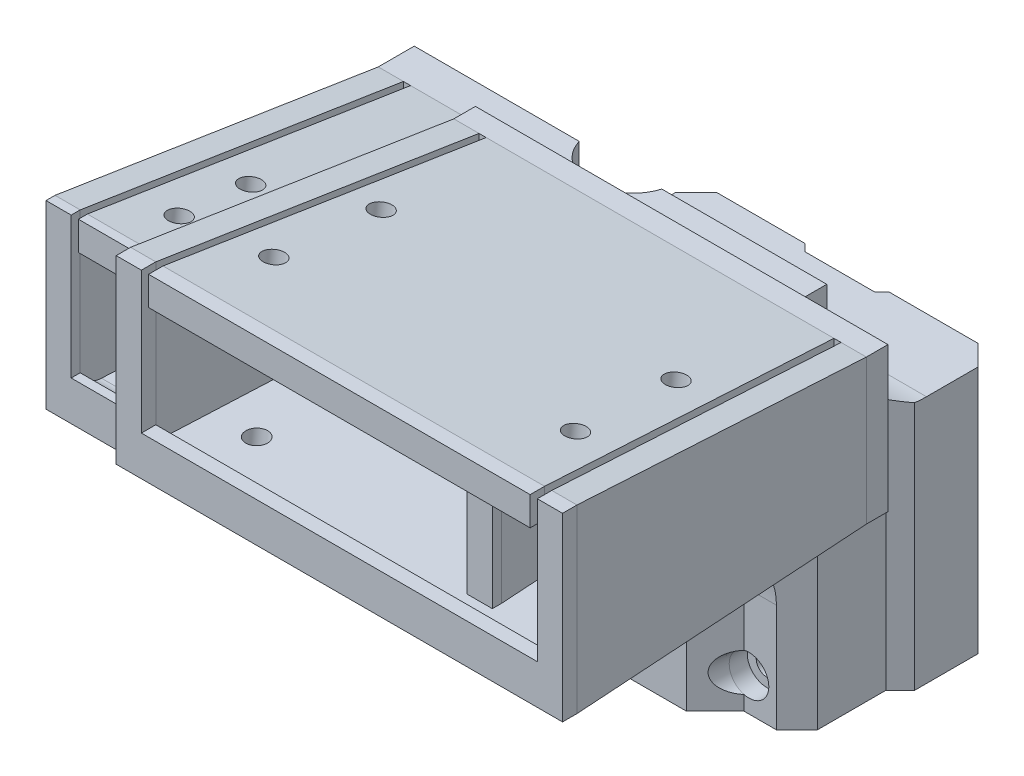
from build123d import *
from build123d.topology import SkipClean

# Parameters (mm, degrees)
BOSS_EXTRUDE1_DEPTH          = 3.5
BOSS_EXTRUDE2_DEPTH          = 31
SKETCH12_52_W                = 57.3
SKETCH12_52_H                = 20.1
BOSS_EXTRUDE5_DEPTH          = 3
SKETCH15_W                   = 53
SKETCH15_H                   = 4
BOSS_EXTRUDE6_DEPTH          = 2
CUT_EXTRUDE2_DEPTH           = 75.496191348
CUT_EXTRUDE2_DEPTH_BACK      = 75.496191348
SKETCH16_R                   = 6
CUT_EXTRUDE3_DEPTH           = 86.717904238
CUT_EXTRUDE3_DEPTH_BACK      = 86.717904238
SKETCH17_R                   = 1.5
CUT_EXTRUDE4_DEPTH           = 75.165575069
CUT_EXTRUDE4_DEPTH_BACK      = 75.165575069
SKETCH18_R                   = 1.5
FILLET7_R                    = 16
SKETCH19_R                   = 2.75
CUT_EXTRUDE5_DEPTH           = 2.5
CUT_EXTRUDE5_OTHER_WAY_DEPTH = 15
CUT_EXTRUDE5_OTHER_WAY_TAPER = -10
CUT_EXTRUDE8_DEPTH           = 88.953922769
CUT_EXTRUDE8_DEPTH_BACK      = 10
SKETCH25_R                   = 1.5
FILLET2_START                = -4
FILLET2_DEPTH                = 12.9999999
FILLET2_START_2              = 21.0000001
FILLET2_2_DEPTH              = 12.9999999
FILLET2_START_3              = -6
FILLET2_3_DEPTH              = 42
FILLET2_START_4              = 3.5
FILLET2_4_OUTLINE_R          = 6
FILLET2_4_DEPTH              = 13.5
SKETCH26_52_W                = 57.3
SKETCH26_52_H                = 20.1
BOSS_EXTRUDE9_DEPTH          = 5
SKETCH29_W                   = 53
SKETCH29_H                   = 4
BOSS_EXTRUDE10_DEPTH         = 1.25
CUT_EXTRUDE9_DEPTH           = 84.818530224
CUT_EXTRUDE9_DEPTH_BACK      = 84.818530224
SKETCH30_R                   = 1.5
CUT_EXTRUDE10_DEPTH          = 78.901749147
CUT_EXTRUDE10_DEPTH_BACK     = 78.901749147
SKETCH31_R                   = 1.75
CUT_EXTRUDE11_DEPTH          = 83.791560676
CUT_EXTRUDE11_DEPTH_BACK     = 83.791560676
SKETCH32_R                   = 6
SKETCH33_R                   = 3
CUT_EXTRUDE12_DEPTH          = 2
FILLET8_START                = -26.15
FILLET8_DEPTH                = 53
FILLET8_START_2              = -28
FILLET8_2_DEPTH              = 57
FILLET8_START_3              = 14.6
FILLET8_3_DEPTH              = 7


with BuildPart() as part:
    # Sketch2 → Boss-Extrude1 (new body)
    with BuildSketch(Plane(origin=(0, 0, 0), x_dir=(1, 0, 0), z_dir=(0, 1, 0))):
        Polygon((26.656854249, -4.5), (31.156854249, -4.5), (34, -1.656854249), (34, 7.843145751), (36, 9.843145751), (36, 18.656854249), (33.156854249, 21.5), (20.843145751, 21.5), (19.843145751, 20.5), (10.156854249, 20.5), (9.156854249, 21.5), (-3.156854249, 21.5), (-6, 18.656854249), (-6, 9.843145751), (-4, 7.843145751), (-4, -1.656854249), (-1.156854249, -4.5), (3.343145751, -4.5), (7.343145751, -8.5), (22.656854249, -8.5), align=None)
    extrude(amount=BOSS_EXTRUDE1_DEPTH)

    # Sketch2<3> → Boss-Extrude2 (add)
    with BuildSketch(Plane(origin=(0, 0, 0), x_dir=(1, 0, 0), z_dir=(0, 1, 0))):
        Polygon((26.656854249, -4.5), (31.156854249, -4.5), (34, -1.656854249), (34, 7.843145751), (36, 9.843145751), (36, 18.656854249), (33.156854249, 21.5), (20.843145751, 21.5), (19.843145751, 20.5), (10.156854249, 20.5), (9.156854249, 21.5), (-3.156854249, 21.5), (-6, 18.656854249), (-6, 9.843145751), (-4, 7.843145751), (-4, -1.656854249), (-1.156854249, -4.5), (3.343145751, -4.5), (7.343145751, -8.5), (22.656854249, -8.5), align=None)
        Polygon((25, -0.5), (29.5, -0.5), (30, 0), (30, 9.5), (32, 11.5), (32, 17), (31.5, 17.5), (22.5, 17.5), (22, 17), (22, 16.5), (8, 16.5), (8, 17), (7.5, 17.5), (-1.5, 17.5), (-2, 17), (-2, 11.5), (0, 9.5), (0, 0), (0.5, -0.5), (5, -0.5), (9, -4.5), (21, -4.5), align=None, mode=Mode.SUBTRACT)
    extrude(amount=-BOSS_EXTRUDE2_DEPTH)

    # Sketch12 → Loft9 section 0
    with BuildSketch(Plane.XY.offset(4.5)):
        with BuildLine():
            Line((40.15, 3.5), (-10.15, 3.5))
            Line((-10.15, 3.5), (-10.15, 18.1))
            Line((-10.15, 18.1), (-10.15, 20.1))
            Line((-10.15, 20.1), (-13.65, 20.1))
            Line((-13.65, 20.1), (-13.65, 0))
            Line((-13.65, 0), (43.65, 0))
            Line((43.65, 0), (43.65, 20.1))
            Line((43.65, 20.1), (40.15, 20.1))
            Line((40.15, 20.1), (40.15, 18.1))
            Line((40.15, 18.1), (40.15, 3.5))
        make_face()
    # Sketch13 → Loft9 section 1
    with BuildSketch(Plane.XY.offset(47.4)):
        with BuildLine():
            Line((-12.15, 3.5), (-12.15, 23.1))
            Line((-12.15, 23.1), (-12.15, 25.1))
            Line((-12.15, 25.1), (-15.65, 25.1))
            Line((-15.65, 25.1), (-15.65, 0))
            Line((-15.65, 0), (46.35, 0))
            Line((46.35, 0), (46.35, 25.1))
            Line((46.35, 25.1), (42.85, 25.1))
            Line((42.85, 25.1), (42.85, 23.1))
            Line((42.85, 23.1), (42.85, 3.5))
            Line((42.85, 3.5), (-12.15, 3.5))
        make_face()
    loft()



with BuildPart() as body_2:
    # Loft10: read off the stored shape, not the designer's step
    # Loft10: loft between two sections, ruled curve by curve
    loft10_from = [
        Edge.make_line((39.15, 18.1, 4.5), (-9.15, 18.1, 4.5)),
        Edge.make_line((-9.15, 18.1, 4.5), (-9.15, 20.1, 4.5)),
        Edge.make_line((39.15, 20.1, 4.5), (39.15, 18.1, 4.5)),
        Edge.make_line((-9.15, 20.1, 4.5), (39.15, 20.1, 4.5)),
    ]
    loft10_to = [
        Edge.make_line((41.85, 23.1, 47.4), (-11.15, 23.1, 47.4)),
        Edge.make_line((-11.15, 23.1, 47.4), (-11.15, 25.1, 47.4)),
        Edge.make_line((41.85, 25.1, 47.4), (41.85, 23.1, 47.4)),
        Edge.make_line((-11.15, 25.1, 47.4), (41.85, 25.1, 47.4)),
    ]
    loft10 = Solid(Shell([*[Face.make_surface_from_curves(loft10_from[k], loft10_to[k]) for k in range(4)], Face(Wire(loft10_from)), Face(Wire(loft10_to))]))
    add(loft10)


with BuildPart() as part_1:
    add(part.part)

    add(body_2.part)  # Boss-Extrude5 merges body 2
    # Sketch12<52> → Boss-Extrude5 (add)
    with BuildSketch(Plane.XY.offset(4.5)):
        with Locations((15, 10.05)):
            Rectangle(SKETCH12_52_W, SKETCH12_52_H)
    extrude(amount=-BOSS_EXTRUDE5_DEPTH)

    # Sketch15 → Boss-Extrude6 (add)
    with BuildSketch(Plane.XY.offset(47.4)):
        Polygon((42.85, 25.1), (42.85, 5.5), (-12.15, 5.5), (-12.15, 25.1), (-15.65, 25.1), (-15.65, 0), (46.35, 0), (46.35, 25.1), align=None)
        with Locations((15.35, 23.1)):
            Rectangle(SKETCH15_W, SKETCH15_H)
    extrude(amount=BOSS_EXTRUDE6_DEPTH)

    # Sketch16 → Cut-Extrude2 (cut, two sides: drawn at the far end of the back side and taken through both)
    with BuildSketch(Plane.XZ.offset(-CUT_EXTRUDE2_DEPTH_BACK)):
        with Locations(Location((15, -6.5, 0), (0, 0, 90))):
            Circle(SKETCH16_R)
    extrude(amount=CUT_EXTRUDE2_DEPTH + CUT_EXTRUDE2_DEPTH_BACK, mode=Mode.SUBTRACT)

    # Sketch17 → Cut-Extrude3 (cut, two sides: drawn at the far end of the back side and taken through both)
    with BuildSketch(Plane(origin=(0, 19.313175656, -2.250952874), x_dir=(1, 0, 0), z_dir=(0, 0.9932764572466327, -0.11576648685858201)).offset(-CUT_EXTRUDE3_DEPTH_BACK)):
        with Locations(Location((-5.681576171, -24.987042894, 0), (0, 0, 270))):
            Circle(SKETCH17_R)
        with Locations(Location((-5.681576171, -39.987042894, 0), (0, 0, 270))):
            Circle(SKETCH17_R)
        with Locations(Location((35.277391984, -24.987042894, 0), (0, 0, 270))):
            Circle(SKETCH17_R)
        with Locations(Location((36.215100527, -39.987042894, 0), (0, 0, 270))):
            Circle(SKETCH17_R)
    extrude(amount=CUT_EXTRUDE3_DEPTH + CUT_EXTRUDE3_DEPTH_BACK, mode=Mode.SUBTRACT)

    # Sketch18 → Cut-Extrude4 (cut, two sides: drawn at the far end of the back side and taken through both)
    with BuildSketch(Plane(origin=(0, 0, 0.5), x_dir=(-1, 0, 0), z_dir=(0, 0, -1)).offset(-CUT_EXTRUDE4_DEPTH_BACK)):
        with Locations(Location((-27.35, -5, 0), (0, 0, 62.477483135))):
            Circle(SKETCH18_R)
        with Locations(Location((-27.35, -26.33, 0), (0, 0, 62.477483135))):
            Circle(SKETCH18_R)
        with Locations((-2.65, -5)):
            Circle(SKETCH18_R)
        with Locations((-2.65, -26.33)):
            Circle(SKETCH18_R)
    extrude(amount=CUT_EXTRUDE4_DEPTH + CUT_EXTRUDE4_DEPTH_BACK, mode=Mode.SUBTRACT)

    # Fillet7
    # the kernel refuses this fillet: 16 mm, written as the material it adds along each edge
    with BuildSketch(Plane(origin=(-13.343145751, 0, 4.5), x_dir=(0, -1, 0), z_dir=(1, 0, 0))) as fillet7_piece_1_section:
        with BuildLine():
            CenterArc((FILLET7_R, -FILLET7_R), FILLET7_R, 90, 90)
            Line((0, -FILLET7_R), (0, 0))
            Line((0, 0), (FILLET7_R, 0))
        make_face()
    fillet7_piece_1 = extrude(amount=84.5, mode=Mode.PRIVATE)
    fillet7_piece_1 = fillet7_piece_1 - Plane(origin=(27.35, -5, 4.5), x_dir=(-0.46209716700003584, 0.8868293005142202, 0), z_dir=(0, 0, -1)) * Cylinder(1.5, 233, mode=Mode.PRIVATE)
    fillet7_piece_1 = split(fillet7_piece_1, bisect_by=Plane(origin=(8.906854249, 0, 26.75), z_dir=(-0.7071067811865474, 0, -0.7071067811865477)), keep=Keep.TOP, mode=Mode.PRIVATE)
    fillet7_piece_1 = split(fillet7_piece_1, bisect_by=Plane(origin=(-7.25, 0, -1.593145751), z_dir=(0.7071067811865477, 0, -0.7071067811865474)), keep=Keep.TOP, mode=Mode.PRIVATE)
    fillet7_piece_1 = fillet7_piece_1 - Plane(origin=(2.65, -5, 4.5), x_dir=(-1, 0, 0), z_dir=(0, 0, -1)) * Cylinder(1.5, 233, mode=Mode.PRIVATE)
    add(fillet7_piece_1)

    # Sketch19 → Cut-Extrude5 (cut)
    with BuildSketch(Plane.XY.offset(4.5)):
        with Locations((2.65, -5)):
            Circle(SKETCH19_R)
        with Locations((27.35, -5)):
            Circle(SKETCH19_R)
        with BuildLine():
            ThreePointArc((3.920767209, -28.768780576), (5.4, -26.33), (3.920767209, -23.891219424))
            ThreePointArc((3.920767209, -23.891219424), (-0.1, -26.33), (3.920767209, -28.768780576))
        make_face()
        with BuildLine():
            ThreePointArc((26.079232791, -28.768780576), (30.1, -26.33), (26.079232791, -23.891219424))
            ThreePointArc((26.079232791, -23.891219424), (24.6, -26.33), (26.079232791, -28.768780576))
        make_face()
    extrude(amount=-CUT_EXTRUDE5_DEPTH, mode=Mode.SUBTRACT)

    # Sketch19 → Cut-Extrude5 other way (cut)
    with BuildSketch(Plane.XY.offset(4.5)):
        with Locations((2.65, -5)):
            Circle(SKETCH19_R)
        with Locations((27.35, -5)):
            Circle(SKETCH19_R)
        with BuildLine():
            ThreePointArc((3.920767209, -28.768780576), (5.4, -26.33), (3.920767209, -23.891219424))
            ThreePointArc((3.920767209, -23.891219424), (-0.1, -26.33), (3.920767209, -28.768780576))
        make_face()
        with BuildLine():
            ThreePointArc((26.079232791, -28.768780576), (30.1, -26.33), (26.079232791, -23.891219424))
            ThreePointArc((26.079232791, -23.891219424), (24.6, -26.33), (26.079232791, -28.768780576))
        make_face()
    extrude(amount=CUT_EXTRUDE5_OTHER_WAY_DEPTH, taper=CUT_EXTRUDE5_OTHER_WAY_TAPER, mode=Mode.SUBTRACT)

    # Sketch25 → Cut-Extrude8 (cut, two sides: drawn at the far end of the back side and taken through both)
    with BuildSketch(Plane.XZ.offset(31).offset(-CUT_EXTRUDE8_DEPTH_BACK)):
        with Locations(Location((8.171572875, 6.5, 0), (0, 0, 90))):
            Circle(SKETCH25_R)
        with Locations(Location((21.421572875, -19.25, 0), (0, 0, 90))):
            Circle(SKETCH25_R)
        with Locations(Location((-3, -9.671572875, 0), (0, 0, 90))):
            Circle(SKETCH25_R)
        with Locations(Location((33, -9.671572875, 0), (0, 0, 90))):
            Circle(SKETCH25_R)
    extrude(amount=CUT_EXTRUDE8_DEPTH + CUT_EXTRUDE8_DEPTH_BACK, mode=Mode.SUBTRACT)

    # Fillet2: read off the stored shape, not the designer's step
    # Fillet2 outline → Fillet2 (add)
    with BuildSketch(Plane.YZ.offset(FILLET2_START)):
        with BuildLine():
            ThreePointArc((3.5, -11.5), (7.307611845, -2.307611845), (16.5, 1.5))
            Line((16.5, 1.5), (3.5, 1.5))
            Line((3.5, 1.5), (3.5, -11.5))
        make_face()
    extrude(amount=FILLET2_DEPTH)

    # Fillet2 2 outline → Fillet2 2 (add)
    with BuildSketch(Plane.YZ.offset(FILLET2_START_2)):
        with BuildLine():
            ThreePointArc((3.5, -11.5), (7.307611845, -2.307611845), (16.5, 1.5))
            Line((16.5, 1.5), (3.5, 1.5))
            Line((3.5, 1.5), (3.5, -11.5))
        make_face()
    extrude(amount=FILLET2_2_DEPTH)

    # Fillet2 3 outline → Fillet2 3 (add)
    with BuildSketch(Plane.YZ.offset(FILLET2_START_3)):
        with BuildLine():
            ThreePointArc((3.5, -11.5), (7.307611845, -2.307611845), (16.5, 1.5))
            Line((16.5, 1.5), (3.5, 1.5))
            Line((3.5, 1.5), (3.5, -11.5))
        make_face()
    extrude(amount=FILLET2_3_DEPTH)

    # Fillet2 4 outline → Fillet2 4 (cut)
    with SkipClean():  # the faces are left unmerged after this step: merging them gives an invalid solid
        with BuildSketch(Plane(origin=(0, 0, 0), x_dir=(1, 0, 0), z_dir=(0, 1, 0)).offset(FILLET2_START_4)):
            Polygon((36, 9.843145751), (34, 7.843145751), (34, -1.5), (36, -1.5), align=None)
            Polygon((-6, -1.5), (-4, -1.5), (-4, 7.843145751), (-6, 9.843145751), align=None)
            with Locations((15, 6.5)):
                Circle(FILLET2_4_OUTLINE_R)
        extrude(amount=FILLET2_4_DEPTH, mode=Mode.SUBTRACT)


with BuildPart() as body_2_2:
    # Sketch26 → Loft11 section 0
    with BuildSketch(Plane.XY):
        with BuildLine():
            Line((25.15, 0), (-25.15, 0))
            Line((-25.15, 0), (-25.15, 14.6))
            Line((-25.15, 14.6), (-25.15, 16.6))
            Line((-25.15, 16.6), (-28.65, 16.6))
            Line((-28.65, 16.6), (-28.65, -3.5))
            Line((-28.65, -3.5), (28.65, -3.5))
            Line((28.65, -3.5), (28.65, 16.6))
            Line((28.65, 16.6), (25.15, 16.6))
            Line((25.15, 16.6), (25.15, 14.6))
            Line((25.15, 14.6), (25.15, 0))
        make_face()
    # Sketch28 → Loft11 section 1
    with BuildSketch(Plane.XY.offset(42.9)):
        with BuildLine():
            Line((-27.15, 0), (-27.15, 19.6))
            Line((-27.15, 19.6), (-27.15, 21.6))
            Line((-27.15, 21.6), (-30.65, 21.6))
            Line((-30.65, 21.6), (-30.65, -3.5))
            Line((-30.65, -3.5), (31.35, -3.5))
            Line((31.35, -3.5), (31.35, 21.6))
            Line((31.35, 21.6), (27.85, 21.6))
            Line((27.85, 21.6), (27.85, 19.6))
            Line((27.85, 19.6), (27.85, 0))
            Line((27.85, 0), (-27.15, 0))
        make_face()
    loft()



with BuildPart() as body_3:
    # Loft12: read off the stored shape, not the designer's step
    # Loft12: loft between two sections, ruled curve by curve
    loft12_from = [
        Edge.make_line((-24.15, 14.6, 0), (-24.15, 16.6, 0)),
        Edge.make_line((-24.15, 16.6, 0), (24.15, 16.6, 0)),
        Edge.make_line((24.15, 14.6, 0), (-24.15, 14.6, 0)),
        Edge.make_line((24.15, 16.6, 0), (24.15, 14.6, 0)),
    ]
    loft12_to = [
        Edge.make_line((-26.15, 19.6, 42.9), (-26.15, 21.6, 42.9)),
        Edge.make_line((-26.15, 21.6, 42.9), (26.85, 21.6, 42.9)),
        Edge.make_line((26.85, 19.6, 42.9), (-26.15, 19.6, 42.9)),
        Edge.make_line((26.85, 21.6, 42.9), (26.85, 19.6, 42.9)),
    ]
    loft12 = Solid(Shell([*[Face.make_surface_from_curves(loft12_from[k], loft12_to[k]) for k in range(4)], Face(Wire(loft12_from)), Face(Wire(loft12_to))]))
    add(loft12)


with BuildPart() as body_2_2_1:
    add(body_2_2.part)

    add(body_3.part)  # Boss-Extrude9 merges body 3
    # Sketch26<52> → Boss-Extrude9 (add)
    with BuildSketch(Plane.XY):
        with Locations((0, 6.55)):
            Rectangle(SKETCH26_52_W, SKETCH26_52_H)
    extrude(amount=-BOSS_EXTRUDE9_DEPTH)

    # Sketch29 → Boss-Extrude10 (add)
    with BuildSketch(Plane.XY.offset(42.9)):
        Polygon((27.85, 21.6), (27.85, 2), (-27.15, 2), (-27.15, 21.6), (-30.65, 21.6), (-30.65, -3.5), (31.35, -3.5), (31.35, 21.6), align=None)
        with Locations((0.35, 19.6)):
            Rectangle(SKETCH29_W, SKETCH29_H)
    extrude(amount=BOSS_EXTRUDE10_DEPTH)

    # Sketch30 → Cut-Extrude9 (cut, two sides: drawn at the far end of the back side and taken through both)
    with BuildSketch(Plane(origin=(0, 16.377528801, -1.908802891), x_dir=(1, 0, 0), z_dir=(0, 0.9932764572466327, -0.11576648685858194)).offset(-CUT_EXTRUDE9_DEPTH_BACK)):
        with Locations(Location((-20.357430008, -28.112116132, 0), (0, 0, 270))):
            Circle(SKETCH30_R)
        with Locations(Location((-20.357430008, -38.112116132, 0), (0, 0, 270))):
            Circle(SKETCH30_R)
        with Locations(Location((20.777503207, -28.112116132, 0), (0, 0, 270))):
            Circle(SKETCH30_R)
        with Locations(Location((21.402642236, -38.112116132, 0), (0, 0, 270))):
            Circle(SKETCH30_R)
    extrude(amount=CUT_EXTRUDE9_DEPTH + CUT_EXTRUDE9_DEPTH_BACK, mode=Mode.SUBTRACT)

    # Sketch31 → Cut-Extrude10 (cut, two sides: drawn at the far end of the back side and taken through both)
    with BuildSketch(Plane(origin=(0, 0, -5), x_dir=(-1, 0, 0), z_dir=(0, 0, -1)).offset(-CUT_EXTRUDE10_DEPTH_BACK)):
        with Locations((-21.65, 6.55)):
            Circle(SKETCH31_R)
        with Locations((21.65, 6.55)):
            Circle(SKETCH31_R)
    extrude(amount=CUT_EXTRUDE10_DEPTH + CUT_EXTRUDE10_DEPTH_BACK, mode=Mode.SUBTRACT)

    # Sketch32 → Cut-Extrude11 (cut, two sides: drawn at the far end of the back side and taken through both)
    with BuildSketch(Plane(origin=(0, 16.6, 0), x_dir=(1, 0, 0), z_dir=(0, 1, 0)).offset(-CUT_EXTRUDE11_DEPTH_BACK)):
        with Locations((0, 6.75)):
            Circle(SKETCH32_R)
    extrude(amount=CUT_EXTRUDE11_DEPTH + CUT_EXTRUDE11_DEPTH_BACK, mode=Mode.SUBTRACT)

    # Sketch33 → Cut-Extrude12 (cut)
    with BuildSketch(Plane.XY):
        with Locations((-21.65, 6.55)):
            Circle(SKETCH33_R)
        with Locations((21.65, 6.55)):
            Circle(SKETCH33_R)
    extrude(amount=-CUT_EXTRUDE12_DEPTH, mode=Mode.SUBTRACT)

    # Fillet8: read off the stored shape, not the designer's step
    # Fillet8 outline → Fillet8 (add)
    with BuildSketch(Plane.YZ.offset(FILLET8_START)):
        with BuildLine():
            ThreePointArc((0, 40.071572875), (0.550510257, 41.803623683), (2, 42.9))
            Line((2, 42.9), (0, 42.9))
            Line((0, 42.9), (0, 40.071572875))
        make_face()
        with BuildLine():
            Line((19.6, 42.9), (17.6, 42.9))
            ThreePointArc((17.6, 42.9), (18.903429264, 41.643238069), (19.246313724, 39.865371751))
            Line((19.246313724, 39.865371751), (19.6, 42.9))
        make_face()
    extrude(amount=FILLET8_DEPTH)

    # Fillet8 2 outline → Fillet8 2 (add)
    with BuildSketch(Plane.YZ.offset(FILLET8_START_2)):
        with BuildLine():
            ThreePointArc((0, 40.071572875), (0.550510257, 41.803623683), (2, 42.9))
            Line((2, 42.9), (0, 42.9))
            Line((0, 42.9), (0, 40.071572875))
        make_face()
    extrude(amount=FILLET8_2_DEPTH)

    # Fillet8 3 outline → Fillet8 3 (cut)
    with BuildSketch(Plane(origin=(0, 0, 0), x_dir=(1, 0, 0), z_dir=(0, 1, 0)).offset(FILLET8_START_3)):
        Polygon((-26.15, -42.9), (-25.921561772, -38), (-26.15, -38), align=None)
        Polygon((26.85, -38), (26.541608392, -38), (26.85, -42.9), align=None)
    extrude(amount=FILLET8_3_DEPTH, mode=Mode.SUBTRACT)


solid = Compound([part_1.part, body_2_2_1.part])
